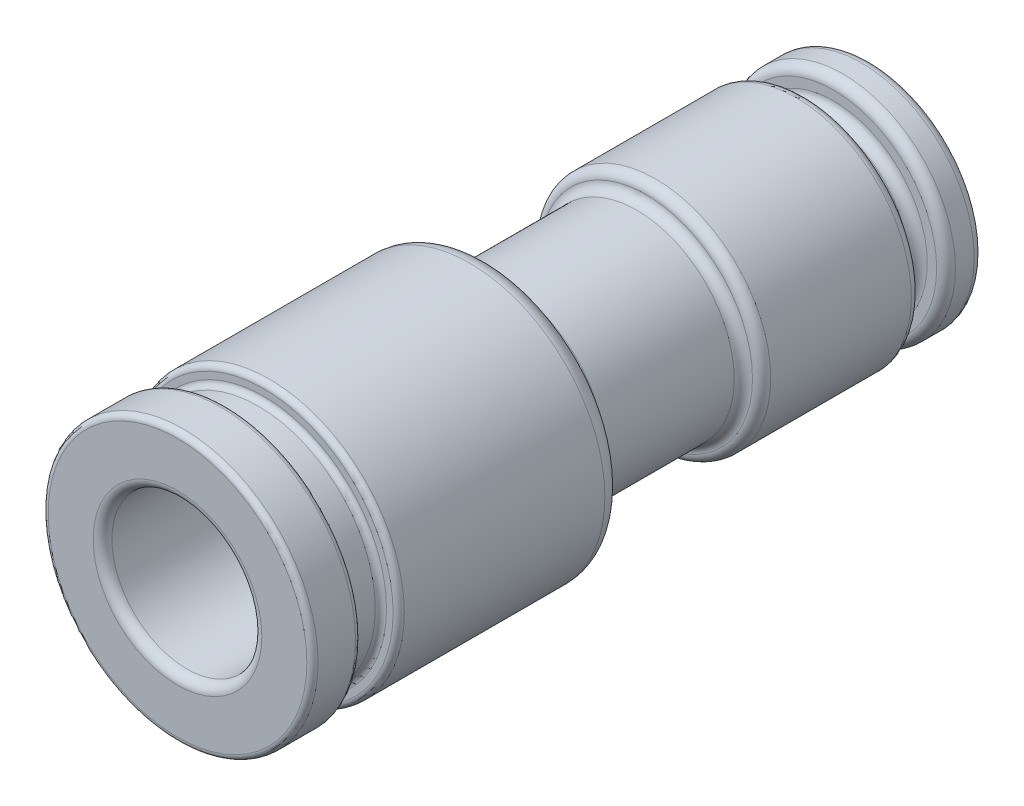
from build123d import *

# Parameters (mm, degrees)
SKETCH1_R           = 6
BOSS_EXTRUDE1_DEPTH = 2
SKETCH2_R           = 4.5
BOSS_EXTRUDE2_DEPTH = 1.5
SKETCH3_R           = 6.15
BOSS_EXTRUDE3_DEPTH = 8.5
SKETCH4_R           = 5.2
BOSS_EXTRUDE6_DEPTH = 8.4
FILLET4_R           = 0.5
FILLET5_R           = 0.5
SKETCH7_R           = 7.2
BOSS_EXTRUDE7_DEPTH = 12
FILLET6_R           = 1
FILLET7_R           = 1
SKETCH8_R           = 6.25
BOSS_EXTRUDE8_DEPTH = 2
SKETCH9_R           = 7.2
BOSS_EXTRUDE9_DEPTH = 2.6
FILLET8_R           = 0.3
FILLET9_R           = 0.3
FILLET10_R          = 0.5
SKETCH10_R          = 4
CUT_EXTRUDE1_DEPTH  = 15
SKETCH11_R          = 3
CUT_EXTRUDE2_DEPTH  = 25.242112179
FILLET11_R          = 1
FILLET12_R          = 1
FILLET13_R          = 0.5
FILLET14_R          = 0.5


with BuildPart() as part:
    # Sketch1 → Boss-Extrude1 (new body)
    with BuildSketch(Plane.XY):
        Circle(SKETCH1_R)
    extrude(amount=BOSS_EXTRUDE1_DEPTH)

    # Sketch2 → Boss-Extrude2 (add)
    with BuildSketch(Plane.XY.offset(2)):
        Circle(SKETCH2_R)
    extrude(amount=BOSS_EXTRUDE2_DEPTH)

    # Sketch3 → Boss-Extrude3 (add)
    with BuildSketch(Plane.XY.offset(3.5)):
        Circle(SKETCH3_R)
    extrude(amount=BOSS_EXTRUDE3_DEPTH)

    # Sketch4 → Boss-Extrude6 (add)
    with BuildSketch(Plane.XY.offset(12)):
        Circle(SKETCH4_R)
    extrude(amount=BOSS_EXTRUDE6_DEPTH)

    # Fillet4
    fillet4_edges = [part.edges().sort_by_distance(p)[0] for p in [
        (-5.2, 0, 12),
    ]]
    fillet(fillet4_edges, radius=FILLET4_R)

    # Fillet5
    fillet5_edges = [part.edges().sort_by_distance(p)[0] for p in [
        (-6.15, 0, 12),
    ]]
    fillet(fillet5_edges, radius=FILLET5_R)

    # Sketch7 → Boss-Extrude7 (add)
    with BuildSketch(Plane.XY.offset(20.4)):
        Circle(SKETCH7_R)
    extrude(amount=BOSS_EXTRUDE7_DEPTH)

    # Fillet6
    fillet6_edges = [part.edges().sort_by_distance(p)[0] for p in [
        (-5.2, 0, 20.4),
    ]]
    fillet(fillet6_edges, radius=FILLET6_R)

    # Fillet7
    fillet7_edges = [part.edges().sort_by_distance(p)[0] for p in [
        (-7.2, 0, 20.4),
    ]]
    fillet(fillet7_edges, radius=FILLET7_R - 0.0001)  # a hair under: the kernel refuses the full size

    # Sketch8 → Boss-Extrude8 (add)
    with BuildSketch(Plane.XY.offset(32.4)):
        Circle(SKETCH8_R)
    extrude(amount=BOSS_EXTRUDE8_DEPTH)

    # Sketch9 → Boss-Extrude9 (add)
    with BuildSketch(Plane.XY.offset(34.4)):
        Circle(SKETCH9_R)
    extrude(amount=BOSS_EXTRUDE9_DEPTH)

    # Fillet8
    fillet8_edges = [part.edges().sort_by_distance(p)[0] for p in [
        (-6.25, 0, 32.4),
        (-6.25, 0, 34.4),
    ]]
    fillet(fillet8_edges, radius=FILLET8_R)

    # Fillet9
    fillet9_edges = [part.edges().sort_by_distance(p)[0] for p in [
        (-7.2, 0, 32.4),
        (-7.2, 0, 34.4),
        (-7.2, 0, 37),
    ]]
    fillet(fillet9_edges, radius=FILLET9_R)

    # Fillet10
    fillet10_edges = [part.edges().sort_by_distance(p)[0] for p in [
        (-6.15, 0, 3.5),
        (-6, 0, 0),
        (-6, 0, 2),
        (-4.5, 0, 2),
        (-4.5, 0, 3.5),
    ]]
    fillet(fillet10_edges, radius=FILLET10_R)

    # Sketch10 → Cut-Extrude1 (cut)
    with BuildSketch(Plane.XY.offset(37)):
        Circle(SKETCH10_R)
    extrude(amount=-CUT_EXTRUDE1_DEPTH, mode=Mode.SUBTRACT)

    # Sketch11 → Cut-Extrude2 (cut, through all)
    with BuildSketch(Plane.XY.offset(22)):
        Circle(SKETCH11_R)
    extrude(amount=-CUT_EXTRUDE2_DEPTH, mode=Mode.SUBTRACT)

    # Fillet11
    fillet11_edges = [part.edges().sort_by_distance(p)[0] for p in [
        (-3, 0, 22),
    ]]
    fillet(fillet11_edges, radius=FILLET11_R - 0.0001)  # a hair under: the kernel refuses the full size

    # Fillet12
    fillet12_edges = [part.edges().sort_by_distance(p)[0] for p in [
        (-4, 0, 22),
    ]]
    fillet(fillet12_edges, radius=FILLET12_R)

    # Fillet13
    fillet13_edges = [part.edges().sort_by_distance(p)[0] for p in [
        (-4, 0, 37),
    ]]
    fillet(fillet13_edges, radius=FILLET13_R)

    # Fillet14
    fillet14_edges = [part.edges().sort_by_distance(p)[0] for p in [
        (-3, 0, 0),
    ]]
    fillet(fillet14_edges, radius=FILLET14_R)


solid = part.part
